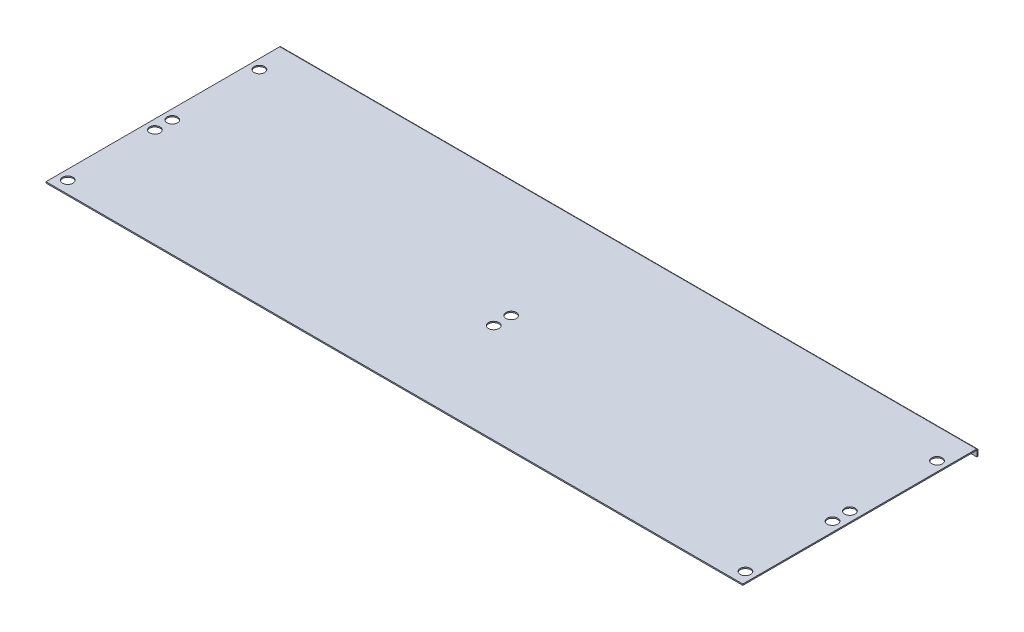
from build123d import *

# Parameters (mm, degrees)
SKETCH_1_W                       = 400
SKETCH_1_H                       = 135
SKETCH_1_R                       = 3
SM_BASE_FLANGE_1_DEPTH           = 0.7
SM_EDGE_FLANGE_1_STRIP_W         = 3.2
SM_EDGE_FLANGE_1_STRIP_H         = 0.7
SM_EDGE_FLANGE_1_STRIP_CUT_DEPTH = 400
SM_EDGE_FLANGE_1_DEPTH           = 400


# Sheet-metal steps are written as plain solids
with BuildPart() as part:
    # Sketch 1 → 基体-法兰1 (new body)
    with BuildSketch(Plane(origin=(0, 0, 0), x_dir=(1, 0, 0), z_dir=(0, 1, 0))):
        Rectangle(SKETCH_1_W, SKETCH_1_H)
        with Locations(Location((-194.5, -60.5, 0), (0, 0, 270))):
            Circle(SKETCH_1_R, mode=Mode.SUBTRACT)
        with Locations(Location((-194.5, -10.5, 0), (0, 0, 270))):
            Circle(SKETCH_1_R, mode=Mode.SUBTRACT)
        with Locations(Location((-194.5, -0.5, 0), (0, 0, 270))):
            Circle(SKETCH_1_R, mode=Mode.SUBTRACT)
        with Locations(Location((-194.5, 49.5, 0), (0, 0, 270))):
            Circle(SKETCH_1_R, mode=Mode.SUBTRACT)
        with Locations(Location((0, -10.5, 0), (0, 0, 270))):
            Circle(SKETCH_1_R, mode=Mode.SUBTRACT)
        with Locations(Location((0, -0.5, 0), (0, 0, 270))):
            Circle(SKETCH_1_R, mode=Mode.SUBTRACT)
        with Locations(Location((194.5, -60.5, 0), (0, 0, 90))):
            Circle(SKETCH_1_R, mode=Mode.SUBTRACT)
        with Locations(Location((194.5, -10.5, 0), (0, 0, 90))):
            Circle(SKETCH_1_R, mode=Mode.SUBTRACT)
        with Locations(Location((194.5, -0.5, 0), (0, 0, 90))):
            Circle(SKETCH_1_R, mode=Mode.SUBTRACT)
        with Locations(Location((194.5, 49.5, 0), (0, 0, 90))):
            Circle(SKETCH_1_R, mode=Mode.SUBTRACT)
    extrude(amount=-SM_BASE_FLANGE_1_DEPTH)

    # 边线-法兰1 strip (across the edge) → 边线-法兰1 strip cut (cut)
    with BuildSketch(Plane(origin=(-200, -0.7, -67.5), x_dir=(0, 0, 1), z_dir=(1, 0, 0))):
        with Locations((-0.7, -0.35)):
            Rectangle(SM_EDGE_FLANGE_1_STRIP_W, SM_EDGE_FLANGE_1_STRIP_H)
    extrude(amount=SM_EDGE_FLANGE_1_STRIP_CUT_DEPTH, mode=Mode.SUBTRACT)

    # 边线-法兰1 section (across the edge) → 边线-法兰1 (add)
    with BuildSketch(Plane(origin=(-200, -0.7, -67.5), x_dir=(0, 0, 1), z_dir=(1, 0, 0))):
        with BuildLine():
            Line((0, 0.2), (0, 3.3))
            Line((0, 3.3), (0.7, 3.3))
            Line((0.7, 3.3), (0.7, 0.2))
            ThreePointArc((0.7, 0.2), (0.758578644, 0.058578644), (0.9, 0))
            Line((0.9, 0), (0.9, -0.7))
            ThreePointArc((0.9, -0.7), (0.263603897, -0.436396103), (0, 0.2))
        make_face()
    extrude(amount=SM_EDGE_FLANGE_1_DEPTH)


solid = part.part
